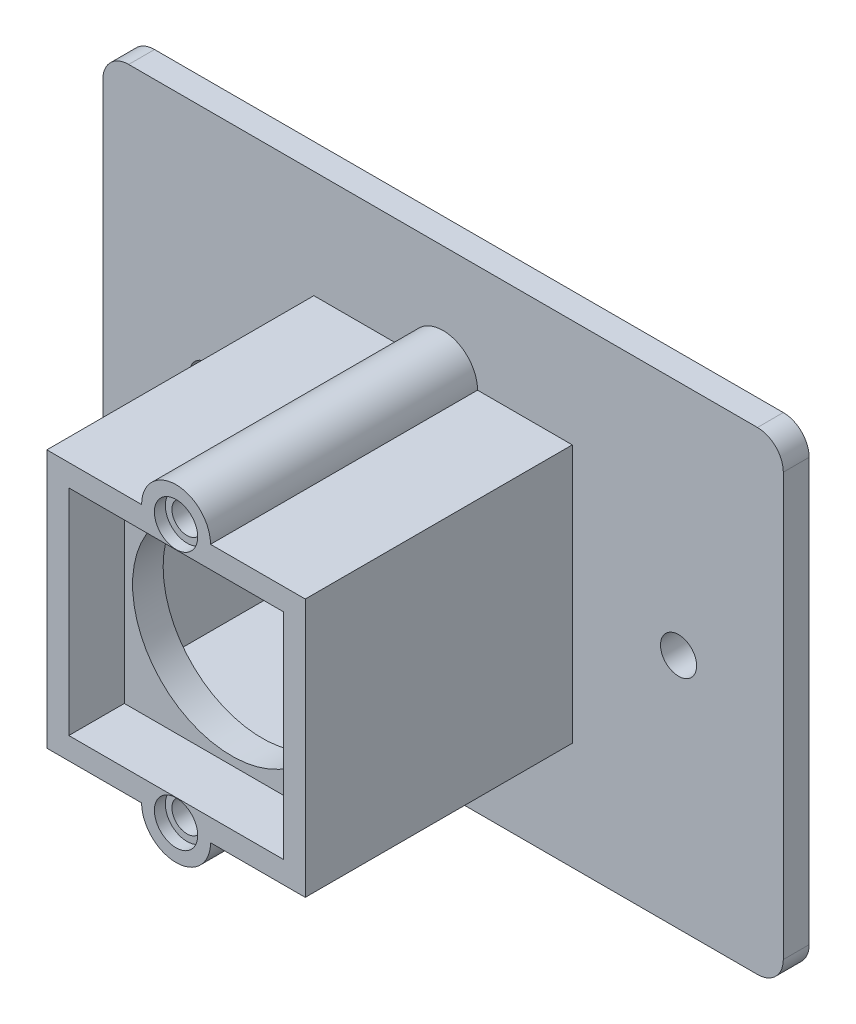
from build123d import *

# Parameters (mm, degrees)
SKETCH1_R            = 1.75
BOSS_EXTRUDE1_DEPTH  = 9
SHELL2_START         = 2.55
SHELL2_OUTLINE_W     = 24.9
SHELL2_OUTLINE_H     = 24.9
SHELL2_DEPTH         = 6.45
CUT_EXTRUDE1_REACH   = 27.052
SKETCH6_R            = 11.5
BOSS_EXTRUDE5_DEPTH  = 25
SHELL7_T             = -1
CUT_EXTRUDE6_START   = -1
SKETCH12_R           = 11.5
CUT_EXTRUDE6_DEPTH   = 1
SKETCH19_W           = 3
SKETCH19_H           = 25.5
BOSS_EXTRUDE17_DEPTH = 23
SKETCH20_W           = 3
SKETCH20_H           = 25.5
BOSS_EXTRUDE18_DEPTH = 23
SKETCH21_W           = 79
SKETCH21_H           = 55
SKETCH21_W_2         = 76
SKETCH21_H_2         = 25.5
BOSS_EXTRUDE19_DEPTH = 3
FILLET1_R            = 3
SKETCH22_R           = 2.0955
CUT_EXTRUDE7_DEPTH   = 3
BOSS_EXTRUDE34_REACH = 56.236
SKETCH37_R           = 2.5146
CUT_EXTRUDE8_DEPTH   = 1.27


# Read off the part's stored shape, not the designer's step: Shell2
with BuildPart() as part:
    # Sketch1 → Boss-Extrude1 (new body)
    with BuildSketch(Plane.XY):
        with BuildLine():
            Line((15, 15), (4, 15))
            ThreePointArc((4, 15), (0, 19), (-4, 15))
            Line((-4, 15), (-15, 15))
            Line((-15, 15), (-15, -15))
            Line((-15, -15), (-4, -15))
            ThreePointArc((-4, -15), (0, -19), (4, -15))
            Line((4, -15), (15, -15))
            Line((15, -15), (15, 15))
        make_face()
        with Locations((0, -15)):
            Circle(SKETCH1_R, mode=Mode.SUBTRACT)
        with Locations((0, 15)):
            Circle(SKETCH1_R, mode=Mode.SUBTRACT)
    extrude(amount=BOSS_EXTRUDE1_DEPTH)

    # Shell2 outline → Shell2 (cut)
    with BuildSketch(Plane.XY.offset(SHELL2_START)):
        Rectangle(SHELL2_OUTLINE_W, SHELL2_OUTLINE_H)
    extrude(amount=SHELL2_DEPTH, mode=Mode.SUBTRACT)

    # Sketch6 → Cut-Extrude1 (cut, up to next)
    with BuildSketch(Plane.XY.offset(2.55), mode=Mode.PRIVATE) as cut_extrude1_sk1:
        Circle(SKETCH6_R)
    cut_extrude1_tool1 = extrude(cut_extrude1_sk1.sketch, amount=-CUT_EXTRUDE1_REACH, mode=Mode.PRIVATE) & part.part
    add(cut_extrude1_tool1.solids().sort_by_distance((0, 0, 2.55))[0], mode=Mode.SUBTRACT)


with BuildPart() as body_2:
    # Sketch11 → Boss-Extrude5 (new body)
    with BuildSketch(Plane(origin=(0, 0, 0), x_dir=(-1, 0, 0), z_dir=(0, 0, -1))):
        Polygon((-15, -12.75), (2.39, -12.75), (15, -12.75), (15, 12.75), (2.39, 12.75), (-15, 12.75), align=None)
    extrude(amount=BOSS_EXTRUDE5_DEPTH)

    # Shell7
    shell7_openings = [body_2.faces().sort_by_distance(p)[0] for p in [
        (0, 0, -25),
    ]]
    offset(amount=SHELL7_T, openings=shell7_openings, kind=Kind.INTERSECTION)

    # Sketch12 → Cut-Extrude6 (cut)
    with BuildSketch(Plane(origin=(0, 0, -1), x_dir=(-1, 0, 0), z_dir=(0, 0, -1)).offset(CUT_EXTRUDE6_START)):
        with Locations(Location((0, 0, 0), (0, 0, 180))):
            Circle(SKETCH12_R)
    extrude(amount=CUT_EXTRUDE6_DEPTH, mode=Mode.SUBTRACT)

    # Sketch19 → Boss-Extrude17 (add)
    with BuildSketch(Plane(origin=(15, 0, 0), x_dir=(0, 0, -1), z_dir=(1, 0, 0))):
        with Locations((23.5, 0)):
            Rectangle(SKETCH19_W, SKETCH19_H)
    extrude(amount=BOSS_EXTRUDE17_DEPTH)

    # Sketch20 → Boss-Extrude18 (add)
    with BuildSketch(Plane.ZY.offset(15)):
        with Locations((-23.5, 0)):
            Rectangle(SKETCH20_W, SKETCH20_H)
    extrude(amount=BOSS_EXTRUDE18_DEPTH)

    # Sketch21 → Boss-Extrude19 (add)
    with BuildSketch(Plane(origin=(0, 0, -25), x_dir=(-1, 0, 0), z_dir=(0, 0, -1))):
        Rectangle(SKETCH21_W, SKETCH21_H)
        Rectangle(SKETCH21_W_2, SKETCH21_H_2, mode=Mode.SUBTRACT)
    extrude(amount=-BOSS_EXTRUDE19_DEPTH)

    # Fillet1
    fillet1_edges = [body_2.edges().sort_by_distance(p)[0] for p in [
        (-39.5, -27.5, -23.5),
        (39.5, -27.5, -23.5),
        (39.5, 27.5, -23.5),
        (-39.5, 27.5, -23.5),
    ]]
    fillet(fillet1_edges, radius=FILLET1_R)

    # Sketch22 → Cut-Extrude7 (cut)
    with BuildSketch(Plane(origin=(0, 0, -25), x_dir=(-1, 0, 0), z_dir=(0, 0, -1))):
        with Locations((-27.34, 0)):
            Circle(SKETCH22_R)
        with Locations((27.34, 0)):
            Circle(SKETCH22_R)
    extrude(amount=-CUT_EXTRUDE7_DEPTH, mode=Mode.SUBTRACT)

    # Sketch31 → Boss-Extrude34 (add, up to next)
    with BuildSketch(Plane(origin=(0, 0, 0), x_dir=(-1, 0, 0), z_dir=(0, 0, -1)), mode=Mode.PRIVATE) as boss_extrude34_sk1:
        with BuildLine():
            Line((15, 15), (4, 15))
            ThreePointArc((4, 15), (0, 19), (-4, 15))
            Line((-4, 15), (-15, 15))
            Line((-15, 15), (-15, 12.75))
            Line((-15, 12.75), (15, 12.75))
            Line((15, 12.75), (15, 15))
        make_face()
    boss_extrude34_tool1 = extrude(boss_extrude34_sk1.sketch, amount=BOSS_EXTRUDE34_REACH, mode=Mode.PRIVATE) - body_2.part
    # Sketch31 → Boss-Extrude34 (add, up to next)
    with BuildSketch(Plane(origin=(0, 0, 0), x_dir=(-1, 0, 0), z_dir=(0, 0, -1)), mode=Mode.PRIVATE) as boss_extrude34_sk2:
        with BuildLine():
            Line((15, -12.75), (-15, -12.75))
            Line((-15, -12.75), (-15, -15))
            Line((-15, -15), (-4, -15))
            ThreePointArc((-4, -15), (0, -19), (4, -15))
            Line((4, -15), (15, -15))
            Line((15, -15), (15, -12.75))
        make_face()
    boss_extrude34_tool2 = extrude(boss_extrude34_sk2.sketch, amount=BOSS_EXTRUDE34_REACH, mode=Mode.PRIVATE) - body_2.part

    add(part.part)  # Boss-Extrude34 merges part
    add(boss_extrude34_tool1.solids().sort_by_distance((0, 14.640831, 0))[0])
    add(boss_extrude34_tool2.solids().sort_by_distance((0, -14.640831, 0))[0])

    # Sketch37 → Cut-Extrude8 (cut)
    with BuildSketch(Plane.XY.offset(9)):
        with Locations((0, 15)):
            Circle(SKETCH37_R)
        with Locations((0, -15)):
            Circle(SKETCH37_R)
    extrude(amount=-CUT_EXTRUDE8_DEPTH, mode=Mode.SUBTRACT)


solid = body_2.part
